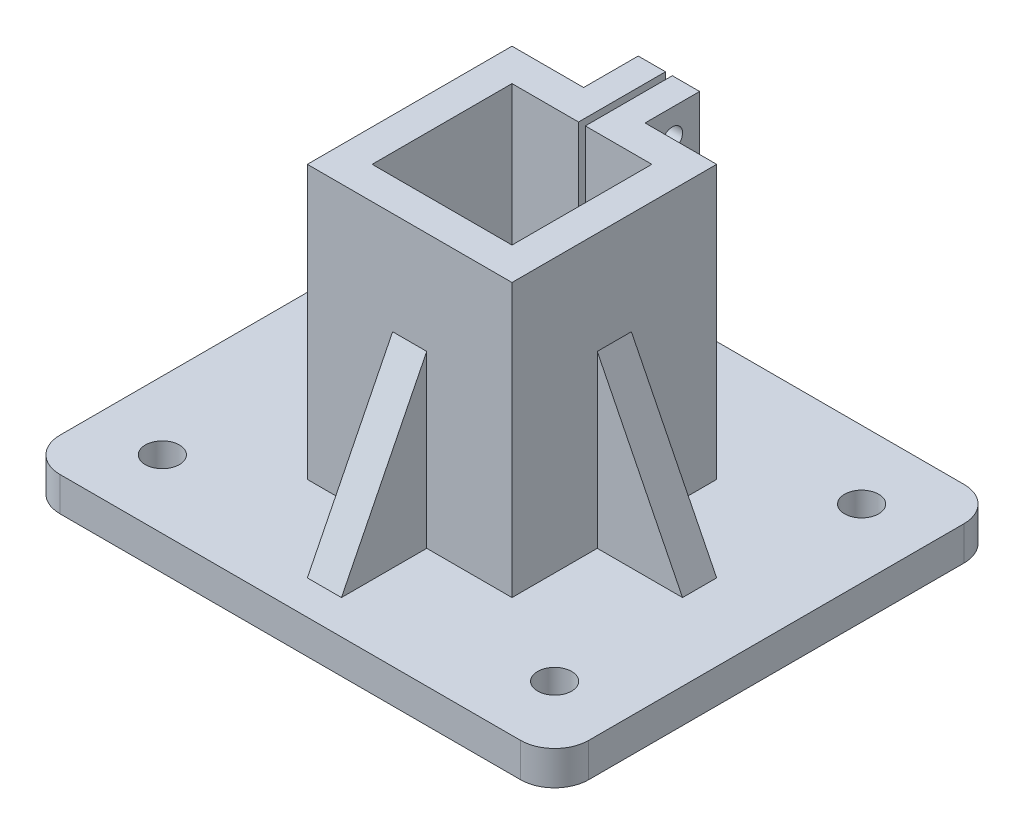
from build123d import *

# Parameters (mm, degrees)
SKETCH1_W                = 77.5
SKETCH1_H                = 65
BOSS_EXTRUDE1_DEPTH      = 5
F_5_0_5_DIAMETER_HOLE1_D = 5
SKETCH4_W                = 30
SKETCH4_H                = 30
BOSS_EXTRUDE2_DEPTH      = 40
CUT_EXTRUDE1_REACH       = 69.696
SKETCH5_W                = 20.5
SKETCH5_H                = 20.5
BOSS_EXTRUDE3_DEPTH      = 2.5
CIRPATTERN1_COUNT        = 2
CIRPATTERN1_ANGLE        = 90
CIRPATTERN2_COUNT        = 2
CIRPATTERN2_ANGLE        = 90
CUT_EXTRUDE4_REACH       = 78.045
SKETCH11_W               = 1
SKETCH11_H               = 40
SKETCH12_W               = 4
SKETCH12_H               = 8
BOSS_EXTRUDE5_DEPTH      = 8
FILLET3_R                = 8
FILLET3_OF_MIRROR2_R     = 8
CUT_EXTRUDE5_REACH       = 72.369
SKETCH13_R               = 2.15
SKETCH14_R               = 2.75
CUT_EXTRUDE6_DEPTH       = 1.5
CUT_EXTRUDE7_REACH       = 72.369
SKETCH15_R               = 1.5
FILLET1_R                = 5


with BuildPart() as part:
    # Sketch1 → Boss-Extrude1 (new body)
    with BuildSketch(Plane(origin=(0, 0, 0), x_dir=(1, 0, 0), z_dir=(0, 1, 0))):
        Rectangle(SKETCH1_W, SKETCH1_H)
    extrude(amount=BOSS_EXTRUDE1_DEPTH)

    # Ø5.0 (5) Diameter Hole1 (through all)
    with Locations(Plane(origin=(-28.75, 5, -22.5), x_dir=(0, 0, 1), z_dir=(0, 1, 0))):
        with Locations((0, 0), (0, 57.5), (45, 57.5), (45, 0)):
            Hole(F_5_0_5_DIAMETER_HOLE1_D / 2)

    # Sketch4 → Boss-Extrude2 (add)
    with BuildSketch(Plane(origin=(0, 5, 0), x_dir=(1, 0, 0), z_dir=(0, 1, 0))):
        Rectangle(SKETCH4_W, SKETCH4_H)
    extrude(amount=BOSS_EXTRUDE2_DEPTH)

    # Sketch5 → Cut-Extrude1 (cut, up to next)
    with BuildSketch(Plane(origin=(0, 45, 0), x_dir=(1, 0, 0), z_dir=(0, 1, 0)), mode=Mode.PRIVATE) as cut_extrude1_sk1:
        Rectangle(SKETCH5_W, SKETCH5_H)
    cut_extrude1_tool1 = extrude(cut_extrude1_sk1.sketch, amount=-CUT_EXTRUDE1_REACH, mode=Mode.PRIVATE) & part.part
    add(cut_extrude1_tool1.solids().sort_by_distance((0, 45, 0))[0], mode=Mode.SUBTRACT)

    # Sketch7 → Boss-Extrude3 (add, symmetric)
    with BuildSketch(Plane(origin=(0, 0, 0), x_dir=(0, 0, -1), z_dir=(1, 0, 0))):
        Polygon((-15, 30), (-27.5, 5), (-15, 5), align=None)
    boss_extrude3 = extrude(amount=BOSS_EXTRUDE3_DEPTH, both=True)

    # CirPattern1: Boss-Extrude3 ×2 about axis
    cirpattern1_axis = Axis((0, 0, 0), (0, 1, 0))
    for i in range(1, CIRPATTERN1_COUNT):
        add(boss_extrude3.rotate(cirpattern1_axis, i * CIRPATTERN1_ANGLE / (CIRPATTERN1_COUNT - 1)))

    # CirPattern2: Boss-Extrude3 ×2 about axis
    cirpattern2_axis = Axis((0, 0, 0), (0, -1, 0))
    for i in range(1, CIRPATTERN2_COUNT):
        add(boss_extrude3.rotate(cirpattern2_axis, i * CIRPATTERN2_ANGLE / (CIRPATTERN2_COUNT - 1)))

    # Sketch11 → Cut-Extrude4 (cut, up to next)
    with BuildSketch(Plane(origin=(0, 0, -15), x_dir=(-1, 0, 0), z_dir=(0, 0, -1)), mode=Mode.PRIVATE) as cut_extrude4_sk1:
        with Locations((0, 25)):
            Rectangle(SKETCH11_W, SKETCH11_H)
    cut_extrude4_tool1 = extrude(cut_extrude4_sk1.sketch, amount=-CUT_EXTRUDE4_REACH, mode=Mode.PRIVATE) & part.part
    add(cut_extrude4_tool1.solids().sort_by_distance((0, 25, -15))[0], mode=Mode.SUBTRACT)

    # Sketch12 → Boss-Extrude5 (add)
    with BuildSketch(Plane(origin=(0, 0, -15), x_dir=(-1, 0, 0), z_dir=(0, 0, -1))):
        with Locations((-2.5, 41)):
            Rectangle(SKETCH12_W, SKETCH12_H)
    boss_extrude5 = extrude(amount=BOSS_EXTRUDE5_DEPTH)

    # Fillet3
    fillet3_edges = [part.edges().sort_by_distance(p)[0] for p in [
        (2.5, 37, -15),
    ]]
    fillet(fillet3_edges, radius=FILLET3_R - 0.0001)  # a hair under: the kernel refuses the full size

    # Mirror2: Boss-Extrude5 across plane
    add(boss_extrude5.mirror(Plane(origin=(0, 0, 0), x_dir=(0, 0, 1), z_dir=(1, 0, 0))))

    # Fillet3 of Mirror2
    fillet3_of_mirror2_edges = [part.edges().sort_by_distance(p)[0] for p in [
        (-2.5, 37, -15),
    ]]
    fillet(fillet3_of_mirror2_edges, radius=FILLET3_OF_MIRROR2_R - 0.0001)  # a hair under: the kernel refuses the full size

    # Sketch13 → Cut-Extrude5 (cut, up to next)
    with BuildSketch(Plane.ZY.offset(4.5), mode=Mode.PRIVATE) as cut_extrude5_sk1:
        with Locations(Location((-19, 41, 0), (0, 0, 270))):
            Circle(SKETCH13_R)
    cut_extrude5_tool1 = extrude(cut_extrude5_sk1.sketch, amount=-CUT_EXTRUDE5_REACH, mode=Mode.PRIVATE) & part.part
    add(cut_extrude5_tool1.solids().sort_by_distance((-4.5, 41, -19))[0], mode=Mode.SUBTRACT)

    # Sketch14 → Cut-Extrude6 (cut)
    with BuildSketch(Plane.ZY.offset(4.5)):
        with Locations(Location((-19, 41, 0), (0, 0, 270))):
            Circle(SKETCH14_R)
    extrude(amount=-CUT_EXTRUDE6_DEPTH, mode=Mode.SUBTRACT)

    # Sketch15 → Cut-Extrude7 (cut, up to next)
    with BuildSketch(Plane(origin=(4.5, 0, 0), x_dir=(0, 0, -1), z_dir=(1, 0, 0)), mode=Mode.PRIVATE) as cut_extrude7_sk1:
        with Locations(Location((19, 41, 0), (0, 0, 90))):
            Circle(SKETCH15_R)
    cut_extrude7_tool1 = extrude(cut_extrude7_sk1.sketch, amount=-CUT_EXTRUDE7_REACH, mode=Mode.PRIVATE) & part.part
    add(cut_extrude7_tool1.solids().sort_by_distance((4.5, 41, -19))[0], mode=Mode.SUBTRACT)

    # Fillet1
    fillet1_edges = [part.edges().sort_by_distance(p)[0] for p in [
        (-38.75, 2.5, -32.5),
        (38.75, 2.5, -32.5),
        (38.75, 2.5, 32.5),
        (-38.75, 2.5, 32.5),
    ]]
    fillet(fillet1_edges, radius=FILLET1_R)


solid = part.part
